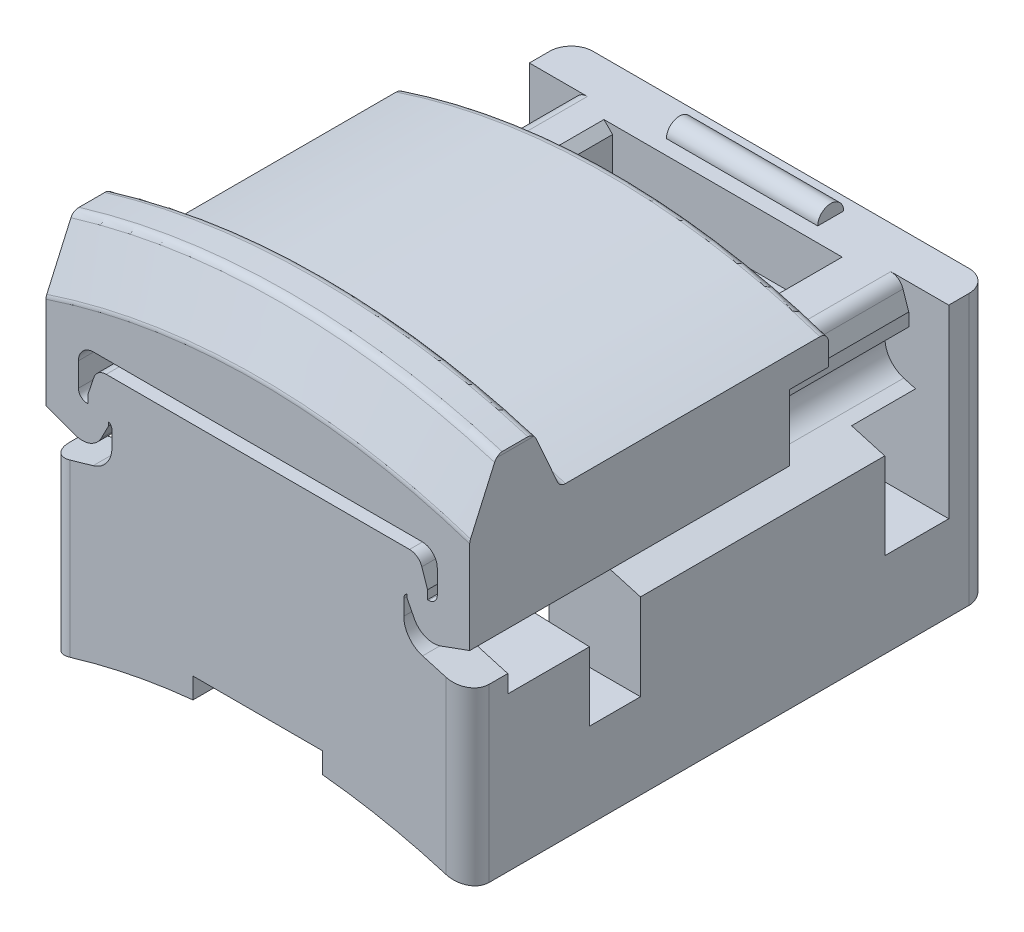
from build123d import *

# Parameters (mm, degrees)
AUFSATZ_LINEAR_AUSTRAGEN1_DEPTH       = 8.3
SCHNITT_ROTATION1_ANGLE               = 30
SCHNITT_ROTATION1_OTHER_WAY_ANGLE     = 30
SCHNITT_LINEAR_AUSTRAGEN1_DEPTH       = 5
SCHNITT_LINEAR_AUSTRAGEN1_DEPTH_BACK  = 5
SKIZZE3_W                             = 0.9
SKIZZE3_H                             = 2.9
AUFSATZ_LINEAR_AUSTRAGEN2_DEPTH       = 12.1
AUFSATZ_LINEAR_START                  = 0.97
AUFSATZ_LINEAR_AUSTRAGEN3_DEPTH       = 0.97
SKIZZE7_W                             = 3
SKIZZE7_H                             = 1
SCHNITT_LINEAR_AUSTRAGEN2_DEPTH       = 2.38
SCHNITT_LINEAR_AUSTRAGEN3_DEPTH       = 6.25
SCHNITT_LINEAR_AUSTRAGEN4_DEPTH       = 4.2
AUFSATZ_LINEAR_AUSTRAGEN4_DEPTH       = 1.75
AUFSATZ_LINEAR_AUSTRAGEN4_DEPTH_BACK  = 1.75
SKIZZE10_R                            = 0.3
SCHNITT_LINEAR_AUSTRAGEN5_DEPTH       = 9.93
SCHNITT_LINEAR_AUSTRAGEN6_DEPTH       = 1.5
SCHNITT_LINEAR_AUSTRAGEN7_DEPTH       = 5
SCHNITT_LINEAR_AUSTRAGEN7_DEPTH_BACK  = 5
SKIZZE13_W                            = 1.48
SKIZZE13_H                            = 2.22
SCHNITT_LINEAR_AUSTRAGEN8_DEPTH       = 5
SCHNITT_LINEAR_AUSTRAGEN8_DEPTH_BACK  = 5
SCHNITT_LINEAR_AUSTRAGEN9_DEPTH       = 3.6
SCHNITT_LINEAR_AUSTRAGEN9_DEPTH_BACK  = 3.6
SKIZZE15_W                            = 3.07
SKIZZE15_H                            = 0.4
AUFSATZ_LINEAR_AUSTRAGEN5_DEPTH       = 2.12
AUFSATZ_LINEAR_AUSTRAGEN6_DEPTH       = 1.965
AUFSATZ_LINEAR_AUSTRAGEN6_DEPTH_BACK  = 1.965
SKIZZE18_W                            = 1.5
SKIZZE18_H                            = 2.8
SCHNITT_LINEAR_AUSTRAGEN10_DEPTH      = 1.5
SCHNITT_LINEAR_AUSTRAGEN10_DEPTH_BACK = 1.5
SCHNITT_LINEAR_AUSTRAGEN11_DEPTH      = 1.5
SCHNITT_LINEAR_AUSTRAGEN11_DEPTH_BACK = 1.5
SCHNITT_LINEAR_AUSTRAGEN12_DEPTH      = 0.65
SCHNITT_LINEAR_AUSTRAGEN12_DEPTH_BACK = 0.65
SKIZZE21_W                            = 1.5
SKIZZE21_H                            = 2.3
AUFSATZ_LINEAR_AUSTRAGEN7_DEPTH       = 0.4
AUFSATZ_LINEAR_AUSTRAGEN7_DEPTH_BACK  = 0.4


with BuildPart() as part:
    # Skizze1 → Aufsatz-Linear austragen1 (new body)
    with BuildSketch(Plane.XY.offset(7.1)):
        with BuildLine():
            Line((-4.9, 8.470741189), (-4.9, 4.92))
            Line((-4.9, 4.92), (-4.234361915, 4.67772755))
            ThreePointArc((-4.234361915, 4.67772755), (-3.88010123, 4.682365077), (-3.617848581, 4.920578611))
            Line((-3.617848581, 4.920578611), (-3.45, 5.25))
            Line((-3.45, 5.25), (-3.45, 5.45))
            Line((-3.45, 5.45), (-3.95, 5.45))
            ThreePointArc((-3.95, 5.45), (-4.091421356, 5.508578644), (-4.15, 5.65))
            Line((-4.15, 5.65), (-4.15, 6.2))
            ThreePointArc((-4.15, 6.2), (-4.047487373, 6.447487373), (-3.8, 6.55))
            Line((-3.8, 6.55), (3.8, 6.55))
            ThreePointArc((3.8, 6.55), (4.047487373, 6.447487373), (4.15, 6.2))
            Line((4.15, 6.2), (4.15, 5.65))
            ThreePointArc((4.15, 5.65), (4.091421356, 5.508578644), (3.95, 5.45))
            Line((3.95, 5.45), (3.45, 5.45))
            Line((3.45, 5.45), (3.45, 5.25))
            Line((3.45, 5.25), (3.617848581, 4.920578611))
            ThreePointArc((3.617848581, 4.920578611), (3.88010123, 4.682365077), (4.234361915, 4.67772755))
            Line((4.234361915, 4.67772755), (4.9, 4.92))
            Line((4.9, 4.92), (4.9, 8.470741189))
            ThreePointArc((4.9, 8.470741189), (4.860195655, 8.590479872), (4.756626478, 8.662557356))
            ThreePointArc((4.756626478, 8.662557356), (-1.5e-08, 9.35), (-4.756626506, 8.662557348))
            ThreePointArc((-4.756626506, 8.662557348), (-4.860195663, 8.59047986), (-4.9, 8.470741189))
        make_face()
    extrude(amount=-AUFSATZ_LINEAR_AUSTRAGEN1_DEPTH)

    # Skizze2 → Schnitt-Rotation1 (revolve, cut)
    with BuildSketch(Plane(origin=(0, 0, 0), x_dir=(0, 0, -1), z_dir=(1, 0, 0))):
        with BuildLine():
            Line((-7.1, 12), (-7.1, 7.854621708))
            ThreePointArc((-7.1, 7.854621708), (-7.095259201, 7.89790963), (-7.081261557, 7.93914536))
            Line((-7.081261557, 7.93914536), (-6.523847505, 9.134523652))
            ThreePointArc((-6.523847505, 9.134523652), (-6.45004587, 9.218678289), (-6.342585948, 9.25))
            Line((-6.342585948, 9.25), (-5.747414052, 9.25))
            ThreePointArc((-5.747414052, 9.25), (-5.63995413, 9.218678289), (-5.566152495, 9.134523652))
            Line((-5.566152495, 9.134523652), (-5.06764755, 8.065476348))
            ThreePointArc((-5.06764755, 8.065476348), (-4.993845914, 7.981321711), (-4.886385992, 7.95))
            Line((-4.886385992, 7.95), (1, 7.95))
            ThreePointArc((1, 7.95), (1.141421356, 7.891421356), (1.2, 7.75))
            Line((1.2, 7.75), (1.2, 12))
            Line((1.2, 12), (-7.1, 12))
        make_face()
    revolve(axis=Axis((0, -7.6, -1.2), (0, 0, -1)), revolution_arc=SCHNITT_ROTATION1_ANGLE, mode=Mode.SUBTRACT)

    # Skizze2 → Schnitt-Rotation1 other way (revolve, cut)
    with BuildSketch(Plane(origin=(0, 0, 0), x_dir=(0, 0, -1), z_dir=(1, 0, 0))):
        with BuildLine():
            Line((-7.1, 12), (-7.1, 7.854621708))
            ThreePointArc((-7.1, 7.854621708), (-7.095259201, 7.89790963), (-7.081261557, 7.93914536))
            Line((-7.081261557, 7.93914536), (-6.523847505, 9.134523652))
            ThreePointArc((-6.523847505, 9.134523652), (-6.45004587, 9.218678289), (-6.342585948, 9.25))
            Line((-6.342585948, 9.25), (-5.747414052, 9.25))
            ThreePointArc((-5.747414052, 9.25), (-5.63995413, 9.218678289), (-5.566152495, 9.134523652))
            Line((-5.566152495, 9.134523652), (-5.06764755, 8.065476348))
            ThreePointArc((-5.06764755, 8.065476348), (-4.993845914, 7.981321711), (-4.886385992, 7.95))
            Line((-4.886385992, 7.95), (1, 7.95))
            ThreePointArc((1, 7.95), (1.141421356, 7.891421356), (1.2, 7.75))
            Line((1.2, 7.75), (1.2, 12))
            Line((1.2, 12), (-7.1, 12))
        make_face()
    revolve(axis=Axis((0, -7.6, -1.2), (0, 0, 1)), revolution_arc=SCHNITT_ROTATION1_OTHER_WAY_ANGLE, mode=Mode.SUBTRACT)

    # Skizze3 → Schnitt-Linear austragen1 (cut, two sides: drawn at the far end of the back side and taken through both)
    with BuildSketch(Plane(origin=(0, 0, 0), x_dir=(0, 0, -1), z_dir=(1, 0, 0)).offset(-SCHNITT_LINEAR_AUSTRAGEN1_DEPTH_BACK)):
        with Locations((0.75, 5)):
            Rectangle(SKIZZE3_W, SKIZZE3_H)
    extrude(amount=SCHNITT_LINEAR_AUSTRAGEN1_DEPTH + SCHNITT_LINEAR_AUSTRAGEN1_DEPTH_BACK, mode=Mode.SUBTRACT)

    # Skizze4 → Aufsatz-Linear austragen2 (add)
    with BuildSketch(Plane.XY.offset(7.1)):
        with BuildLine():
            Line((-4.85, 3.97), (-4.85, 0))
            ThreePointArc((-4.85, 0), (0, 0.805722984), (4.85, 0))
            Line((4.85, 0), (4.85, 3.97))
            Line((4.85, 3.97), (3.809617587, 4.268324856))
            ThreePointArc((3.809617587, 4.268324856), (3.495818694, 4.48399286), (3.375, 4.845081874))
            Line((3.375, 4.845081874), (3.375, 5.2))
            ThreePointArc((3.375, 5.2), (3.418933983, 5.306066017), (3.525, 5.35))
            Line((3.525, 5.35), (3.925, 5.35))
            Line((3.925, 5.35), (3.925, 5.65))
            Line((3.925, 5.65), (3.792770808, 6.045191397))
            ThreePointArc((3.792770808, 6.045191397), (3.683548611, 6.193472195), (3.508273712, 6.25))
            Line((3.508273712, 6.25), (-3.508273712, 6.25))
            ThreePointArc((-3.508273712, 6.25), (-3.683548611, 6.193472195), (-3.792770808, 6.045191397))
            Line((-3.792770808, 6.045191397), (-3.925, 5.65))
            Line((-3.925, 5.65), (-3.925, 5.35))
            Line((-3.925, 5.35), (-3.525, 5.35))
            ThreePointArc((-3.525, 5.35), (-3.418933983, 5.306066017), (-3.375, 5.2))
            Line((-3.375, 5.2), (-3.375, 4.845081874))
            ThreePointArc((-3.375, 4.845081874), (-3.495818694, 4.48399286), (-3.809617587, 4.268324856))
            Line((-3.809617587, 4.268324856), (-4.85, 3.97))
        make_face()
    extrude(amount=-AUFSATZ_LINEAR_AUSTRAGEN2_DEPTH)

    # Skizze5 → Aufsatz-Linear austragen3 (add)
    with BuildSketch(Plane.XY.offset(-5).offset(AUFSATZ_LINEAR_START)):
        with BuildLine():
            Line((4.85, 0), (4.85, 6.25))
            Line((4.85, 6.25), (-4.85, 6.25))
            Line((-4.85, 6.25), (-4.85, 0))
            ThreePointArc((-4.85, 0), (0, 0.805722984), (4.85, 0))
        make_face()
    extrude(amount=-AUFSATZ_LINEAR_AUSTRAGEN3_DEPTH)

    # Skizze6 → Schnitt-Rotation2 (revolve, cut)
    with BuildSketch(Plane.XY):
        with BuildLine():
            Line((0, 3.96), (3.1, 3.96))
            ThreePointArc((3.1, 3.96), (3.206066017, 3.916066017), (3.25, 3.81))
            Line((3.25, 3.81), (3.25, 3.68))
            Line((3.25, 3.68), (3.83, 3.68))
            ThreePointArc((3.83, 3.68), (4.042132034, 3.592132034), (4.13, 3.38))
            Line((4.13, 3.38), (4.13, 0))
            Line((4.13, 0), (0, 0))
            Line((0, 0), (0, 3.96))
        make_face()
    revolve(axis=Axis((0, 0, 0), (0, 1, 0)), mode=Mode.SUBTRACT)

    # Skizze7 → Schnitt-Linear austragen2 (cut)
    with BuildSketch(Plane.XY.offset(7.1)):
        with Locations((0, 0.71)):
            Rectangle(SKIZZE7_W, SKIZZE7_H)
    extrude(amount=-SCHNITT_LINEAR_AUSTRAGEN2_DEPTH, mode=Mode.SUBTRACT)

    # Skizze8 → Schnitt-Linear austragen3 (cut)
    with BuildSketch(Plane(origin=(0, 0, 0), x_dir=(1, 0, 0), z_dir=(0, 1, 0))):
        with BuildLine():
            Line((-7, 4.5), (-4.85, 4.5))
            ThreePointArc((-4.85, 4.5), (-4.703553391, 4.853553391), (-4.35, 5))
            Line((-4.35, 5), (4.35, 5))
            ThreePointArc((4.35, 5), (4.703553391, 4.853553391), (4.85, 4.5))
            Line((4.85, 4.5), (7, 4.5))
            Line((7, 4.5), (7, 7))
            Line((7, 7), (-7, 7))
            Line((-7, 7), (-7, 4.5))
        make_face()
    extrude(amount=SCHNITT_LINEAR_AUSTRAGEN3_DEPTH, mode=Mode.SUBTRACT)

    # Skizze9 → Schnitt-Linear austragen4 (cut)
    with BuildSketch(Plane(origin=(0, 0, 0), x_dir=(1, 0, 0), z_dir=(0, 1, 0))):
        with BuildLine():
            Line((-7, -6.6), (-7, -9))
            Line((-7, -9), (7, -9))
            Line((7, -9), (7, -6.6))
            Line((7, -6.6), (4.85, -6.6))
            ThreePointArc((4.85, -6.6), (4.703553391, -6.953553391), (4.35, -7.1))
            Line((4.35, -7.1), (-4.35, -7.1))
            ThreePointArc((-4.35, -7.1), (-4.703553391, -6.953553391), (-4.85, -6.6))
            Line((-4.85, -6.6), (-7, -6.6))
        make_face()
    extrude(amount=SCHNITT_LINEAR_AUSTRAGEN4_DEPTH, mode=Mode.SUBTRACT)

    # Skizze10 → Aufsatz-Linear austragen4 (add, two sides: drawn at the far end of the back side and taken through both)
    with BuildSketch(Plane(origin=(0, 0, 0), x_dir=(0, 0, -1), z_dir=(1, 0, 0)).offset(-AUFSATZ_LINEAR_AUSTRAGEN4_DEPTH_BACK)):
        with Locations((4.4, 6.25)):
            Circle(SKIZZE10_R)
    extrude(amount=AUFSATZ_LINEAR_AUSTRAGEN4_DEPTH + AUFSATZ_LINEAR_AUSTRAGEN4_DEPTH_BACK)

    # Skizze11 → Schnitt-Linear austragen5 (cut)
    with BuildSketch(Plane.XY.offset(6.17)):
        Polygon((-2.855, 6.25), (-2.655, 6.05), (-2.655, 4.95), (2.655, 4.95), (2.655, 6.25), align=None)
    extrude(amount=-SCHNITT_LINEAR_AUSTRAGEN5_DEPTH, mode=Mode.SUBTRACT)

    # Skizze12 → Schnitt-Linear austragen6 (cut)
    with BuildSketch(Plane(origin=(0, 4.95, 0), x_dir=(1, 0, 0), z_dir=(0, 1, 0))):
        with BuildLine():
            Line((-2.655, -6.17), (2.655, -6.17))
            Line((2.655, -6.17), (2.655, 0.03))
            ThreePointArc((2.655, 0.03), (2.069213562, 1.444213562), (0.655, 2.03))
            Line((0.655, 2.03), (-0.655, 2.03))
            ThreePointArc((-0.655, 2.03), (-2.069213562, 1.444213562), (-2.655, 0.03))
            Line((-2.655, 0.03), (-2.655, -6.17))
        make_face()
    extrude(amount=-SCHNITT_LINEAR_AUSTRAGEN6_DEPTH, mode=Mode.SUBTRACT)

    # Skizze13 → Schnitt-Linear austragen7 (cut, two sides: drawn at the far end of the back side and taken through both)
    with BuildSketch(Plane(origin=(0, 0, 0), x_dir=(0, 0, -1), z_dir=(1, 0, 0)).offset(-SCHNITT_LINEAR_AUSTRAGEN7_DEPTH_BACK)):
        with Locations((3.29, 3.08)):
            Rectangle(SKIZZE13_W, SKIZZE13_H)
    extrude(amount=SCHNITT_LINEAR_AUSTRAGEN7_DEPTH + SCHNITT_LINEAR_AUSTRAGEN7_DEPTH_BACK, mode=Mode.SUBTRACT)

    # Skizze14 → Schnitt-Linear austragen8 (cut, two sides: drawn at the far end of the back side and taken through both)
    with BuildSketch(Plane(origin=(0, 0, 0), x_dir=(0, 0, -1), z_dir=(1, 0, 0)).offset(-SCHNITT_LINEAR_AUSTRAGEN8_DEPTH_BACK)):
        Polygon((-6.17, 3.48), (-4.28, 3.48), (-4.28, 1.97), (-3.1, 1.97), (-3.1, 4.45), (-6.17, 4.45), align=None)
    extrude(amount=SCHNITT_LINEAR_AUSTRAGEN8_DEPTH + SCHNITT_LINEAR_AUSTRAGEN8_DEPTH_BACK, mode=Mode.SUBTRACT)

    # Skizze15 → Schnitt-Linear austragen9 (cut, two sides: drawn at the far end of the back side and taken through both)
    with BuildSketch(Plane(origin=(0, 0, 0), x_dir=(0, 0, -1), z_dir=(1, 0, 0)).offset(-SCHNITT_LINEAR_AUSTRAGEN9_DEPTH_BACK)):
        with Locations((-4.635, 4.55)):
            Rectangle(SKIZZE15_W, SKIZZE15_H)
    extrude(amount=SCHNITT_LINEAR_AUSTRAGEN9_DEPTH + SCHNITT_LINEAR_AUSTRAGEN9_DEPTH_BACK, mode=Mode.SUBTRACT)

    # Skizze16 → Aufsatz-Linear austragen5 (add)
    with BuildSketch(Plane.XY.offset(6.4)):
        Polygon((-4.85, 1.74), (4.85, 1.74), (4.85, 3.561428269), (2.6, 3.64), (-2.6, 3.64), (-4.85, 3.561428269), align=None)
    extrude(amount=-AUFSATZ_LINEAR_AUSTRAGEN5_DEPTH)

    # Skizze17 → Aufsatz-Linear austragen6 (add, two sides: drawn at the far end of the back side and taken through both)
    with BuildSketch(Plane(origin=(0, 0, 0), x_dir=(0, 0, -1), z_dir=(1, 0, 0)).offset(-AUFSATZ_LINEAR_AUSTRAGEN6_DEPTH_BACK)):
        with BuildLine():
            Line((-6.5, 5.17), (-6.5, 3.8))
            Line((-6.5, 3.8), (-6.17, 3.8))
            ThreePointArc((-6.17, 3.8), (-6.023553391, 4.153553391), (-5.67, 4.3))
            Line((-5.67, 4.3), (-2.307634489, 4.3))
            ThreePointArc((-2.307634489, 4.3), (-2.099355889, 4.32193046), (-1.900212581, 4.38675995))
            Line((-1.900212581, 4.38675995), (0.19, 5.319262196))
            Line((0.19, 5.319262196), (0.19, 6.22))
            Line((0.19, 6.22), (0, 6.22))
            Line((0, 6.22), (-2.978647157, 4.893820842))
            Line((-2.978647157, 4.893820842), (-4.62, 4.67))
            Line((-4.62, 4.67), (-5.67, 4.67))
            ThreePointArc((-5.67, 4.67), (-6.023553391, 4.816446609), (-6.17, 5.17))
            Line((-6.17, 5.17), (-6.5, 5.17))
        make_face()
    extrude(amount=AUFSATZ_LINEAR_AUSTRAGEN6_DEPTH + AUFSATZ_LINEAR_AUSTRAGEN6_DEPTH_BACK)

    # Skizze18 → Rotation1 (revolve)
    with BuildSketch(Plane(origin=(0, 0, 0), x_dir=(0, 0, -1), z_dir=(1, 0, 0))):
        with Locations((-0.56, 4.82)):
            Rectangle(SKIZZE18_W, SKIZZE18_H)
    revolve(axis=Axis((0, 6.22, -0.19), (0, -1, 0)))

    # Skizze19 → Schnitt-Linear austragen10 (cut, two sides: drawn at the far end of the back side and taken through both)
    with BuildSketch(Plane(origin=(0, 0, 0), x_dir=(0, 0, -1), z_dir=(1, 0, 0)).offset(-SCHNITT_LINEAR_AUSTRAGEN10_DEPTH_BACK)):
        Polygon((-1.5, 5.552156972), (0, 6.22), (0, 7.22), (-1.5, 7.22), align=None)
    extrude(amount=SCHNITT_LINEAR_AUSTRAGEN10_DEPTH + SCHNITT_LINEAR_AUSTRAGEN10_DEPTH_BACK, mode=Mode.SUBTRACT)

    # Skizze20 → Schnitt-Linear austragen11 (cut, two sides: drawn at the far end of the back side and taken through both)
    with BuildSketch(Plane(origin=(0, 0, 0), x_dir=(0, 0, -1), z_dir=(1, 0, 0)).offset(-SCHNITT_LINEAR_AUSTRAGEN11_DEPTH_BACK)):
        Polygon((0.19, 6.22), (1.555795724, 3.92), (1.69, 3.92), (1.69, 6.22), align=None)
    extrude(amount=SCHNITT_LINEAR_AUSTRAGEN11_DEPTH + SCHNITT_LINEAR_AUSTRAGEN11_DEPTH_BACK, mode=Mode.SUBTRACT)

    # Skizze21 → Schnitt-Linear austragen12 (cut, two sides: drawn at the far end of the back side and taken through both)
    with BuildSketch(Plane(origin=(0, 0, 0), x_dir=(0, 0, -1), z_dir=(1, 0, 0)).offset(-SCHNITT_LINEAR_AUSTRAGEN12_DEPTH_BACK)):
        with Locations((0.94, 5.07)):
            Rectangle(SKIZZE21_W, SKIZZE21_H)
    extrude(amount=SCHNITT_LINEAR_AUSTRAGEN12_DEPTH + SCHNITT_LINEAR_AUSTRAGEN12_DEPTH_BACK, mode=Mode.SUBTRACT)

    # Skizze22 → Aufsatz-Linear austragen7 (add, two sides: drawn at the far end of the back side and taken through both)
    with BuildSketch(Plane(origin=(0, 0, 0), x_dir=(0, 0, -1), z_dir=(1, 0, 0)).offset(-AUFSATZ_LINEAR_AUSTRAGEN7_DEPTH_BACK)):
        Polygon((-0.612857385, 3.61), (-0.55, 1.81), (0.95, 1.81), (1.012857385, 3.61), align=None)
    extrude(amount=AUFSATZ_LINEAR_AUSTRAGEN7_DEPTH + AUFSATZ_LINEAR_AUSTRAGEN7_DEPTH_BACK)


solid = part.part
